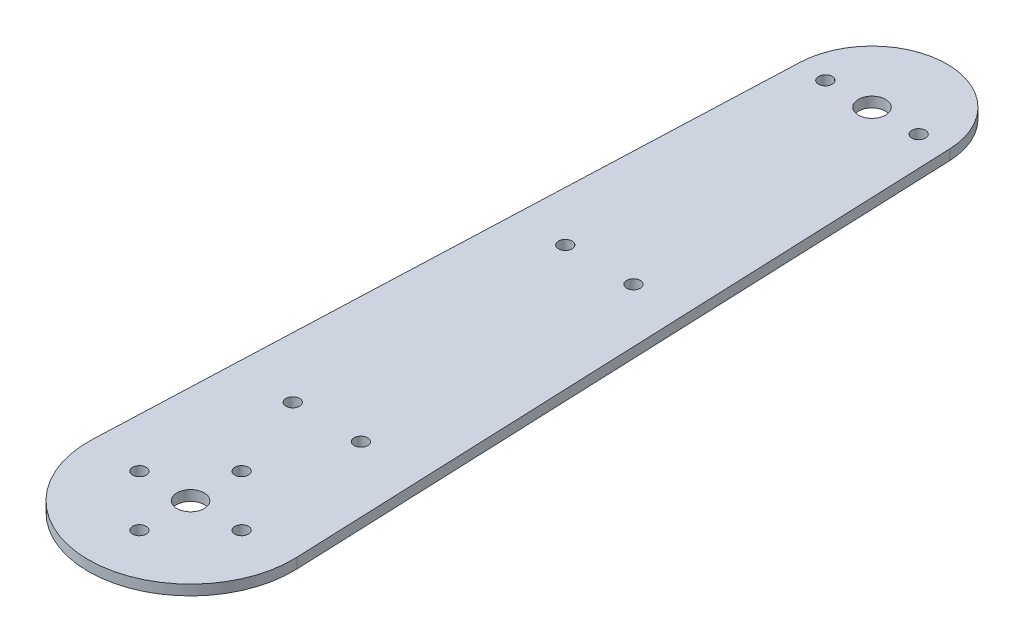
from build123d import *

# Parameters (mm, degrees)
SKETCH_1_R             = 4
SKETCH_1_R_2           = 2
SM_BASE_FLANGE_1_DEPTH = 3


# Sheet-metal steps are written as plain solids
with BuildPart() as part:
    # Sketch 1 → 基体-法兰1 (new body)
    with BuildSketch(Plane(origin=(0, 0, 0), x_dir=(1, 0, 0), z_dir=(0, 1, 0))):
        with BuildLine():
            Line((21.982392954, 200.88), (29.975990392, 1.2))
            ThreePointArc((29.975990392, 1.2), (0, -30), (-29.975990392, 1.2))
            Line((-29.975990392, 1.2), (-21.982392954, 200.88))
            ThreePointArc((-21.982392954, 200.88), (0, 222), (21.982392954, 200.88))
        make_face()
        with Locations(Location((0, 0, 0), (0, 0, 270))):
            Circle(SKETCH_1_R, mode=Mode.SUBTRACT)
        with Locations(Location((0, 200, 0), (0, 0, 270))):
            Circle(SKETCH_1_R, mode=Mode.SUBTRACT)
        with Locations(Location((10, 120, 0), (0, 0, 270))):
            Circle(SKETCH_1_R_2, mode=Mode.SUBTRACT)
        with Locations(Location((-10, 120, 0), (0, 0, 270))):
            Circle(SKETCH_1_R_2, mode=Mode.SUBTRACT)
        with Locations(Location((10, 40, 0), (0, 0, 270))):
            Circle(SKETCH_1_R_2, mode=Mode.SUBTRACT)
        with Locations(Location((-10, 40, 0), (0, 0, 270))):
            Circle(SKETCH_1_R_2, mode=Mode.SUBTRACT)
        with Locations(Location((0, 15, 0), (0, 0, 270))):
            Circle(SKETCH_1_R_2, mode=Mode.SUBTRACT)
        with Locations(Location((15, 0, 0), (0, 0, 270))):
            Circle(SKETCH_1_R_2, mode=Mode.SUBTRACT)
        with Locations(Location((0, -15, 0), (0, 0, 270))):
            Circle(SKETCH_1_R_2, mode=Mode.SUBTRACT)
        with Locations(Location((-15, 0, 0), (0, 0, 270))):
            Circle(SKETCH_1_R_2, mode=Mode.SUBTRACT)
        with Locations(Location((-13.693032158, 200, 0), (0, 0, 270))):
            Circle(SKETCH_1_R_2, mode=Mode.SUBTRACT)
        with Locations(Location((13.693032158, 200, 0), (0, 0, 90))):
            Circle(SKETCH_1_R_2, mode=Mode.SUBTRACT)
    extrude(amount=-SM_BASE_FLANGE_1_DEPTH)


solid = part.part
